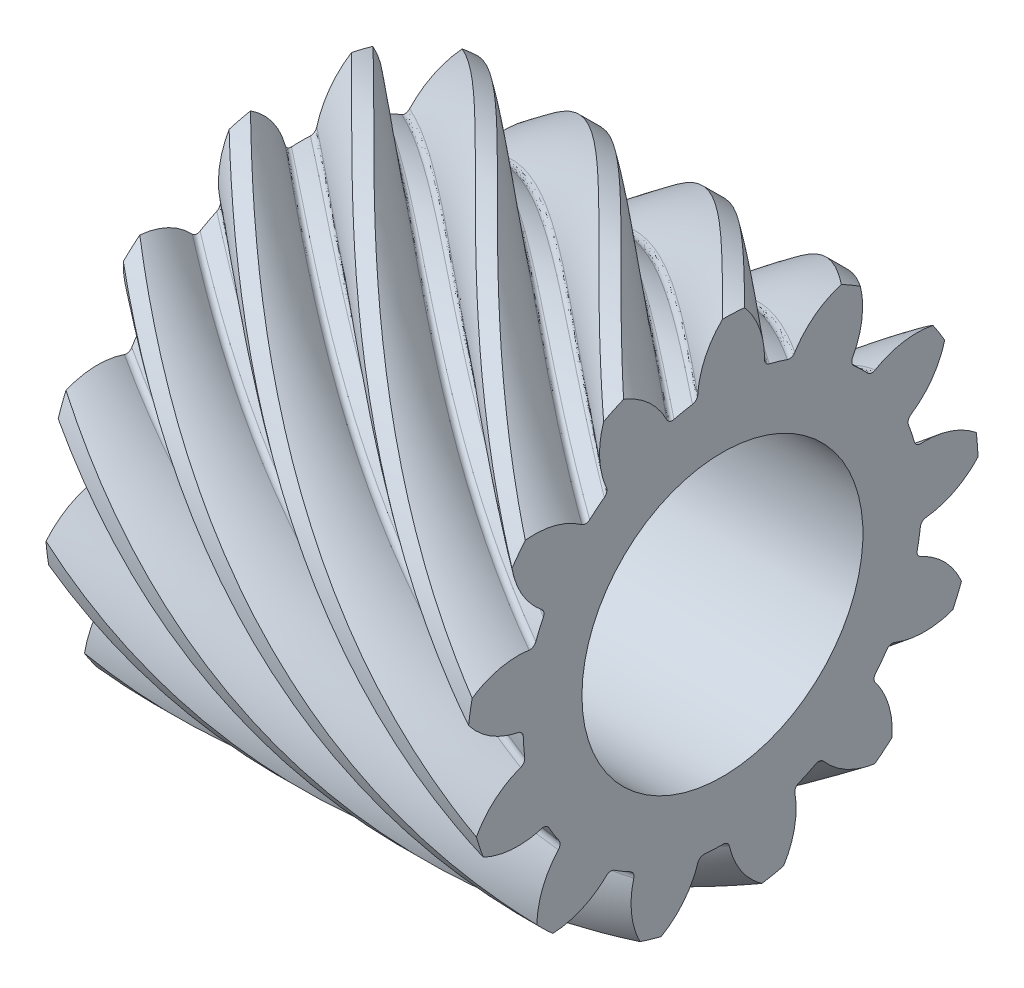
from build123d import *

# Parameters (mm, degrees)
BASPROSKE_W            = 21
BASPROSKE_H            = 12.740485194
TOOTHCUTRH_PITCH       = 80.050829379
TOOTHCUTRH_HEIGHT      = 21
TOOTHCUTRH_RADIUS      = 12.740485194
TOOTHCUTRH_START_ANGLE = -90
TEETHCUTSRH_COUNT      = 13
TEETHCUTSRH_ANGLE      = 332.307692308
BORSKE_R               = 7
BORE_DEPTH             = 62.5000025


with BuildPart() as part:
    # BasProSke → Base-Revolve (revolve)
    with BuildSketch(Plane(origin=(0, 0, 0), x_dir=(1, 0, 0), z_dir=(0, 1, 0)), mode=Mode.PRIVATE) as base_revolve_sk:
        with Locations((10.5, 6.370242597)):
            Rectangle(BASPROSKE_W, BASPROSKE_H)
    revolve(base_revolve_sk.sketch.rotate(Axis((-10, 0, 0), (1, 0, 0)), 180), axis=Axis((-10, 0, 0), (1, 0, 0)))

    # ToothCutRH: sweep along a helix
    with BuildLine() as toothcutrh_path:
        add(Helix(TOOTHCUTRH_PITCH, TOOTHCUTRH_HEIGHT, TOOTHCUTRH_RADIUS, center=(0, 0, 0), direction=(1, 0, 0), mode=Mode.PRIVATE).rotate(Axis((0, 0, 0), (1, 0, 0)), TOOTHCUTRH_START_ANGLE))
    # TooCutSkeRH → ToothCutRH (sweep, cut)
    with BuildSketch(Plane(origin=(0, 0, 0), x_dir=(0, 0, -1), z_dir=(1, 0, 0))):
        with BuildLine():
            ThreePointArc((0.469914325, 9.916857897), (0, 9.927985194), (-0.469914325, 9.916857897))
            ThreePointArc((-0.469914325, 9.916857897), (-0.668810123, 9.97622468), (-0.787020868, 10.146841715))
            ThreePointArc((-0.787020868, 10.146841715), (-1.614600302, 11.707273608), (-3.026182182, 12.769004273))
            ThreePointArc((-3.026182182, 12.769004273), (0, 13.12269975), (3.026182182, 12.769004273))
            ThreePointArc((3.026182182, 12.769004273), (1.614600302, 11.707273608), (0.787020868, 10.146841715))
            ThreePointArc((0.787020868, 10.146841715), (0.668810123, 9.97622468), (0.469914325, 9.916857897))
        make_face()
    toothcutrh = sweep(path=toothcutrh_path.line, is_frenet=True, mode=Mode.SUBTRACT)

    # TeethCutsRH: ToothCutRH ×13 about axis
    teethcutsrh_axis = Axis((-10, 0, 0), (1, 0, 0))
    for i in range(1, TEETHCUTSRH_COUNT):
        add(toothcutrh.rotate(teethcutsrh_axis, i * TEETHCUTSRH_ANGLE / (TEETHCUTSRH_COUNT - 1)), mode=Mode.SUBTRACT)

    # BorSke → Bore (cut, symmetric)
    with BuildSketch(Plane(origin=(0, 0, 0), x_dir=(0, 0, -1), z_dir=(1, 0, 0))):
        with Locations(Location((0, 0, 0), (0, 0, 180))):
            Circle(BORSKE_R)
    extrude(amount=BORE_DEPTH, both=True, mode=Mode.SUBTRACT)


solid = part.part
